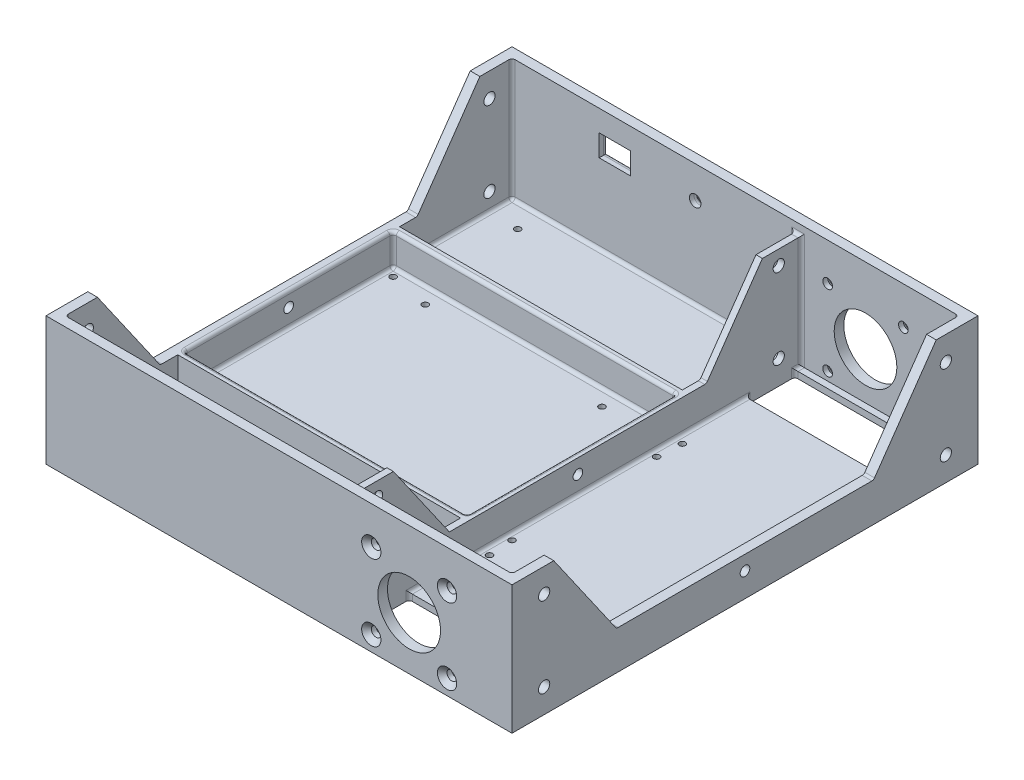
from build123d import *

# Parameters (mm, degrees)
SKETCH_1_W                = 290
SKETCH_1_H                = 290
EXTRUDE_1_DEPTH           = 4
EXTRUDE_2_DEPTH           = 76
SKETCH_4_W                = 6
SKETCH_4_H                = 290
EXTRUDE_3_DEPTH           = 76
CUT_EXTRUDE_12_DEPTH      = 334.95358959
CUT_EXTRUDE_12_DEPTH_BACK = 334.95358959
SKETCH_17_R               = 19.5
SKETCH_17_R_2             = 3
SKETCH_18_W               = 4
SKETCH_18_H               = 290
EXTRUDE_4_DEPTH           = 70
CUT_EXTRUDE_13_DEPTH      = 334.95358959
CUT_EXTRUDE_13_DEPTH_BACK = 334.95358959
SKETCH_14_W               = 80
SKETCH_14_H               = 30
CUT_EXTRUDE_9_DEPTH       = 20
EXTRUDE_1_2_OUTLINE_W     = 176
EXTRUDE_1_2_OUTLINE_H     = 4
EXTRUDE_1_2_DEPTH         = 20
CUT_EXTRUDE_10_DEPTH      = 334.95358959
CUT_EXTRUDE_10_DEPTH_BACK = 334.95358959
SKETCH_15_R               = 3
SKETCH_15_R_2             = 3.5
SKETCH_7_R                = 1.9
CUT_EXTRUDE_3_DEPTH       = 10
FILLET_1_R                = 2
SKETCH_21_R               = 3.6
SKETCH_21_W               = 19.5
SKETCH_21_H               = 13.5
CUT_EXTRUDE_14_DEPTH      = 10
CHAMFER_1_SIZE            = 2
FILLET_2_R                = 3
CHAMFER_2_SIZE            = 3


# Read off the part's stored shape, not the designer's step: Вытянуть-Тонкостенный1
with BuildPart() as part:
    # Эскиз1 → Extrude 1 (new body)
    with BuildSketch(Plane(origin=(0, 0, 0), x_dir=(1, 0, 0), z_dir=(0, 1, 0))):
        Rectangle(SKETCH_1_W, SKETCH_1_H)
    extrude(amount=EXTRUDE_1_DEPTH)

    # Эскиз2 → Бобышка-Вытянуть2 (add)
    with BuildSketch(Plane(origin=(0, 4, 0), x_dir=(1, 0, 0), z_dir=(0, 1, 0))):
        Polygon((145, 145), (145, 0.239524614), (145, -145), (-139, -145), (-139, -139), (139, -139), (139, 139), (-139, 139), (-139, 145), align=None)
    extrude(amount=EXTRUDE_2_DEPTH)

    # Эскиз4 → Бобышка-Вытянуть3 (add)
    with BuildSketch(Plane(origin=(0, 4, 0), x_dir=(1, 0, 0), z_dir=(0, 1, 0))):
        with Locations((-142, 0)):
            Rectangle(SKETCH_4_W, SKETCH_4_H)
    extrude(amount=EXTRUDE_3_DEPTH)

    # Эскиз17 → Вырез-Вытянуть12 (cut, two sides: drawn at the far end of the back side and taken through both)
    with BuildSketch(Plane.XY.offset(145).offset(-CUT_EXTRUDE_12_DEPTH_BACK)):
        with Locations((81, 33)):
            Circle(SKETCH_17_R)
        with Locations((57.43, 56.57)):
            Circle(SKETCH_17_R_2)
        with Locations((104.57, 56.57)):
            Circle(SKETCH_17_R_2)
        with Locations((104.57, 9.43)):
            Circle(SKETCH_17_R_2)
        with Locations((57.43, 9.43)):
            Circle(SKETCH_17_R_2)
    extrude(amount=CUT_EXTRUDE_12_DEPTH + CUT_EXTRUDE_12_DEPTH_BACK, mode=Mode.SUBTRACT)

    # Эскиз18 → Бобышка-Вытянуть4 (add)
    with BuildSketch(Plane(origin=(0, 4, 0), x_dir=(1, 0, 0), z_dir=(0, 1, 0))):
        with Locations((39, 0)):
            Rectangle(SKETCH_18_W, SKETCH_18_H)
    extrude(amount=EXTRUDE_4_DEPTH)

    # Эскиз19 → Вырез-Вытянуть13 (cut, two sides: drawn at the far end of the back side and taken through both)
    with BuildSketch(Plane(origin=(145, 0, 0), x_dir=(0, 0, -1), z_dir=(1, 0, 0)).offset(-CUT_EXTRUDE_13_DEPTH_BACK)):
        Polygon((-80, 24), (80, 24), (119, 80), (-119, 80), align=None)
    extrude(amount=CUT_EXTRUDE_13_DEPTH + CUT_EXTRUDE_13_DEPTH_BACK, mode=Mode.SUBTRACT)

    # Эскиз14 → Вырез-Вытянуть9 (cut)
    with BuildSketch(Plane(origin=(0, 4, 0), x_dir=(1, 0, 0), z_dir=(0, 1, 0))):
        with Locations((81, 120)):
            Rectangle(SKETCH_14_W, SKETCH_14_H)
        with Locations((81, -120)):
            Rectangle(SKETCH_14_W, SKETCH_14_H)
    extrude(amount=-CUT_EXTRUDE_9_DEPTH, mode=Mode.SUBTRACT)

    # Extrude 1 2 outline → Extrude 1 2 (add)
    with BuildSketch(Plane(origin=(0, 4, 0), x_dir=(1, 0, 0), z_dir=(0, 1, 0))):
        with Locations((-51, 67)):
            Rectangle(EXTRUDE_1_2_OUTLINE_W, EXTRUDE_1_2_OUTLINE_H)
        with Locations((-51, -67)):
            Rectangle(EXTRUDE_1_2_OUTLINE_W, EXTRUDE_1_2_OUTLINE_H)
    extrude(amount=EXTRUDE_1_2_DEPTH)

    # Эскиз15 → Вырез-Вытянуть10 (cut, two sides: drawn at the far end of the back side and taken through both)
    with BuildSketch(Plane.ZY.offset(145).offset(-CUT_EXTRUDE_10_DEPTH_BACK)):
        with Locations((0, 65)):
            Circle(SKETCH_15_R)
        with Locations((125, 65)):
            Circle(SKETCH_15_R_2)
        with Locations((-125, 65)):
            Circle(SKETCH_15_R_2)
        with Locations((-125, 15)):
            Circle(SKETCH_15_R_2)
        with Locations((125, 15)):
            Circle(SKETCH_15_R_2)
        with Locations((0, 15)):
            Circle(SKETCH_15_R)
    extrude(amount=CUT_EXTRUDE_10_DEPTH + CUT_EXTRUDE_10_DEPTH_BACK, mode=Mode.SUBTRACT)

    # Эскиз7 → Вырез-Вытянуть3 (cut)
    with BuildSketch(Plane(origin=(0, 4, 0), x_dir=(1, 0, 0), z_dir=(0, 1, 0))):
        with Locations(Location((-109, 55, 0), (0, 0, 270))):
            Circle(SKETCH_7_R)
        with Locations(Location((1, 55, 0), (0, 0, 90))):
            Circle(SKETCH_7_R)
        with Locations(Location((1, -55, 0), (0, 0, 270))):
            Circle(SKETCH_7_R)
        with Locations(Location((-109, -55, 0), (0, 0, 90))):
            Circle(SKETCH_7_R)
        with Locations(Location((-134, 60, 0), (0, 0, 270))):
            Circle(SKETCH_7_R)
        with Locations(Location((-134, -60, 0), (0, 0, 90))):
            Circle(SKETCH_7_R)
        with Locations(Location((134, 134, 0), (0, 0, 270))):
            Circle(SKETCH_7_R)
        with Locations(Location((134, -134, 0), (0, 0, 90))):
            Circle(SKETCH_7_R)
        with Locations(Location((134, -60, 0), (0, 0, 270))):
            Circle(SKETCH_7_R)
        with Locations(Location((134, 60, 0), (0, 0, 90))):
            Circle(SKETCH_7_R)
        with Locations(Location((46, -60, 0), (0, 0, 90))):
            Circle(SKETCH_7_R)
        with Locations(Location((46, 60, 0), (0, 0, 270))):
            Circle(SKETCH_7_R)
        with Locations(Location((45, 45, 0), (0, 0, 270))):
            Circle(SKETCH_7_R)
        with Locations(Location((135, 45, 0), (0, 0, 270))):
            Circle(SKETCH_7_R)
        with Locations(Location((45, -45, 0), (0, 0, 270))):
            Circle(SKETCH_7_R)
        with Locations(Location((135, -45, 0), (0, 0, 270))):
            Circle(SKETCH_7_R)
        with Locations(Location((-121, 124.5, 0), (0, 0, 270))):
            Circle(SKETCH_7_R)
        with Locations(Location((-121, 74.5, 0), (0, 0, 270))):
            Circle(SKETCH_7_R)
        with Locations(Location((19, 124.5, 0), (0, 0, 270))):
            Circle(SKETCH_7_R)
        with Locations(Location((19, 74.5, 0), (0, 0, 270))):
            Circle(SKETCH_7_R)
        with Locations(Location((19, -74.5, 0), (0, 0, 90))):
            Circle(SKETCH_7_R)
        with Locations(Location((19, -124.5, 0), (0, 0, 90))):
            Circle(SKETCH_7_R)
        with Locations(Location((-121, -74.5, 0), (0, 0, 90))):
            Circle(SKETCH_7_R)
        with Locations(Location((-121, -124.5, 0), (0, 0, 90))):
            Circle(SKETCH_7_R)
    extrude(amount=-CUT_EXTRUDE_3_DEPTH, mode=Mode.SUBTRACT)

    # Скругление1
    fillet_1_edges = [part.edges().sort_by_distance(p)[0] for p in [
        (-142, 24, -80),
        (-142, 24, 80),
        (39, 24, -80),
        (-139, 24, 0),
        (-51, 24, -65),
        (37, 24, 0),
        (-51, 24, 65),
        (142, 24, 80),
        (139, 4, 0),
        (139, 42, 139),
        (139, 42, -139),
        (-51, 4, 139),
        (37, 39, 139),
        (39, 74, 139),
        (41, 39, 139),
        (-139, 42, 139),
        (-139, 4, 104),
        (142, 24, -80),
        (121, 2, 135),
        (41, 2, 135),
        (41, 4, 137),
        (41, 2, 105),
        (41, 4, 0),
        (41, 2, -105),
        (41, 2, -135),
        (41, 4, -137),
        (41, 39, -139),
        (121, 2, 105),
        (121, 2, -105),
        (121, 2, -135),
        (-139, 4, -104),
        (-139, 42, -139),
        (39, 74, -139),
        (37, 39, -139),
        (-51, 4, -139),
        (-51, 4, 69),
        (37, 4, 104),
        (37, 4, -104),
        (-51, 4, -69),
        (-139, 4, 0),
        (-139, 14, -65),
        (-139, 14, 65),
        (37, 14, -65),
        (-51, 4, -65),
        (37, 4, 0),
        (37, 14, 65),
        (-51, 4, 65),
    ]]
    fillet(fillet_1_edges, radius=FILLET_1_R)

    # Эскиз21 → Вырез-Вытянуть14 (cut)
    with BuildSketch(Plane(origin=(0, 0, -145), x_dir=(-1, 0, 0), z_dir=(0, 0, -1))):
        with Locations((25, 60)):
            Circle(SKETCH_21_R)
        with Locations((75, 60)):
            Rectangle(SKETCH_21_W, SKETCH_21_H)
    extrude(amount=-CUT_EXTRUDE_14_DEPTH, mode=Mode.SUBTRACT)

    # Фаска1
    chamfer_1_edges = [part.edges().sort_by_distance(p)[0] for p in [
        (-21.4, 60, -145),
        (-84.75, 60, -145),
        (-75, 66.75, -145),
        (-65.25, 60, -145),
        (-75, 53.25, -145),
    ]]
    chamfer(chamfer_1_edges, length=CHAMFER_1_SIZE)

    # Скругление2
    fillet_2_edges = [part.edges().sort_by_distance(p)[0] for p in [
        (-84.75, 60, -143),
        (-75, 66.75, -143),
        (-65.25, 60, -143),
        (-75, 53.25, -143),
        (-21.4, 60, -143),
    ]]
    fillet(fillet_2_edges, radius=FILLET_2_R)

    # Фаска2
    chamfer_2_edges = [part.edges().sort_by_distance(p)[0] for p in [
        (54.43, 9.43, 145),
        (54.43, 9.43, -145),
        (101.57, 9.43, 145),
        (101.57, 9.43, -145),
        (101.57, 56.57, 145),
        (101.57, 56.57, -145),
        (54.43, 56.57, 145),
        (54.43, 56.57, -145),
    ]]
    chamfer(chamfer_2_edges, length=CHAMFER_2_SIZE)


solid = part.part
